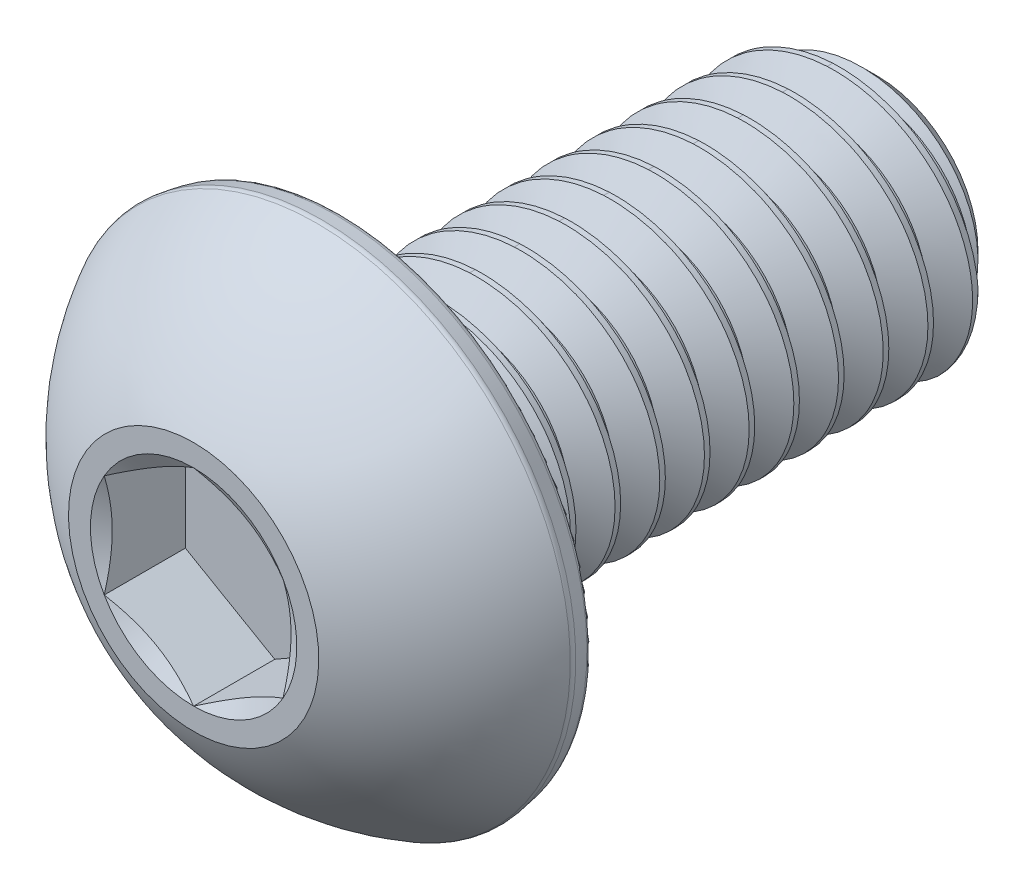
from build123d import *

# Parameters (mm, degrees)
CUT_EXTRUDE1_DEPTH  = 0.9075
FILLET1_R           = 0.0825
CUT_SWEEP1_PITCH    = 0.5
SKETCH7_R           = 1.5
BOSS_EXTRUDE1_DEPTH = 1.25
BOSS_EXTRUDE1_DRAFT = -45
FILLET2_R           = 0.0825


with BuildPart() as part:
    # Sketch2 → Revolve1 (revolve)
    with BuildSketch(Plane(origin=(0, 0, 0), x_dir=(0, 0, -1), z_dir=(1, 0, 0))):
        with BuildLine():
            Line((6, 0), (-1.65, 0))
            Line((-1.65, 0), (-1.65, 1.4))
            ThreePointArc((-1.65, 1.4), (-1.065284323, 2.237716819), (-0.2475, 2.85))
            Line((-0.2475, 2.85), (0, 2.806359072))
            Line((0, 2.806359072), (0, 1.5))
            Line((0, 1.5), (5.625, 1.5))
            Line((5.625, 1.5), (6, 1.125))
            Line((6, 1.125), (6, 0))
        make_face()
    revolve(axis=Axis((0, 0, -6), (0, 0, 1)))

    # Sketch3 → Cut-Extrude1 (cut)
    with BuildSketch(Plane.XY.offset(1.65)):
        Polygon((0, 1.154700538), (-1, 0.577350269), (-1, -0.577350269), (0, -1.154700538), (1, -0.577350269), (1, 0.577350269), align=None)
    extrude(amount=-CUT_EXTRUDE1_DEPTH, mode=Mode.SUBTRACT)

    # Cut-Extrude2 cone 1 section (through the dimple's axis) → Cut-Extrude2 (revolve, cut)
    with BuildSketch(Plane(origin=(0, 0, 1.65), x_dir=(0, -1, 0), z_dir=(1, 0, 0))):
        Polygon((0, 0), (1.154700538, 0), (0, 0.666666667), align=None)
    revolve(axis=Axis((0, 0, 1.65), (0, 0, -1)), mode=Mode.SUBTRACT)

    # Fillet1
    fillet1_edges = [part.edges().sort_by_distance(p)[0] for p in [
        (0, -2.85, 0.2475),
        (0, -2.806359072, 0),
    ]]
    fillet(fillet1_edges, radius=FILLET1_R)


with BuildPart() as body_2:
    # Split1: the piece on the far side of the plane
    add(part.part)
    split(bisect_by=Plane.XY.offset(-0.225), keep=Keep.BOTTOM)

    # Cut-Sweep1: the profile of Sketch5 screwed along a right-hand helix of 13 turns, 6 arcs to a turn; built about Z, then put on its axis
    cut_sweep1_z = Axis((0, 0, 0), (0, 0, 1))
    cut_sweep1_corners = [(1.527063294, 0, 0.015625), (1.527063294, 0, -0.453125), (1.175240474, 0, -0.25), (1.175240474, 0, -0.1875)]
    with BuildLine(mode=Mode.PRIVATE) as cut_sweep1_profile:
        Line(cut_sweep1_corners[0], cut_sweep1_corners[1])
        Line(cut_sweep1_corners[1], cut_sweep1_corners[2])
        Line(cut_sweep1_corners[2], cut_sweep1_corners[3])
        Line(cut_sweep1_corners[3], cut_sweep1_corners[0])
    cut_sweep1_cap = Face(cut_sweep1_profile.wire())
    cut_sweep1_turn_angles = [0, 30, 60, 90, 120, 150, 180, 210, 240, 270, 300, 330, 360]
    cut_sweep1_turn_weights = [1, 0.8660254037844387, 1, 0.8660254037844387, 1, 0.8660254037844387, 1, 0.8660254037844387, 1, 0.8660254037844387, 1, 0.8660254037844387, 1]
    cut_sweep1_turn_rails = [Edge.make_bspline([Vector(p[0], p[1], 0).rotate(cut_sweep1_z, cut_sweep1_turn_angles[k]) / cut_sweep1_turn_weights[k] + Vector(0, 0, p[2] + CUT_SWEEP1_PITCH * cut_sweep1_turn_angles[k] / 360) for k in range(13)], [0, 0, 0, 1, 1, 2, 2, 3, 3, 4, 4, 5, 5, 6, 6, 6], 2, cut_sweep1_turn_weights) for p in cut_sweep1_corners]
    cut_sweep1_turn_sides = [Face.make_surface_from_curves(cut_sweep1_turn_rails[p[0]], cut_sweep1_turn_rails[p[1]]) for p in [(0, 1), (1, 2), (2, 3), (3, 0)]]
    cut_sweep1 = Plane(origin=(0, 0, -6), x_dir=(0, 1, 0), z_dir=(0, 0, 1)) * Solid(Shell([*[p.moved(Location((0, 0, CUT_SWEEP1_PITCH * i))) for i in range(13) for p in cut_sweep1_turn_sides], cut_sweep1_cap, cut_sweep1_cap.rotate(cut_sweep1_z, 4680).moved(Location((0, 0, CUT_SWEEP1_PITCH * 4680 / 360)))]))
    add(cut_sweep1, mode=Mode.SUBTRACT)


with BuildPart() as part_1:
    add(part.part)

    # Split1
    split(bisect_by=Plane.XY.offset(-0.225), keep=Keep.TOP)


with BuildPart() as body_2_1:
    add(body_2.part)

    # Combine1: union part
    add(part_1.part)


with BuildPart() as boss_extrude1_tool:
    # Sketch7 → Boss-Extrude1 (with draft: the straight prism first)
    with BuildSketch(Plane.XY.offset(-0.225)):
        with Locations(Location((0, 0, 0), (0, 0, 90))):
            Circle(SKETCH7_R)
    extrude(amount=-BOSS_EXTRUDE1_DEPTH)
    # Boss-Extrude1: the draft: its side faces are tilted about the plane it starts from
    boss_extrude1_sides = [boss_extrude1_tool.faces().sort_by_distance(p)[0] for p in [
        (0, -1.5, -0.85),
    ]]
    draft(boss_extrude1_sides, Plane.XY.offset(-0.225), BOSS_EXTRUDE1_DRAFT)


with BuildPart() as body_2_2:
    add(body_2_1.part)

    # Boss-Extrude1: add boss_extrude1_tool
    add(boss_extrude1_tool.part)

    # Fillet2
    fillet2_edges = [body_2_2.edges().sort_by_distance(p)[0] for p in [
        (0, -1.5, 0),
    ]]
    fillet(fillet2_edges, radius=FILLET2_R)


solid = body_2_2.part
